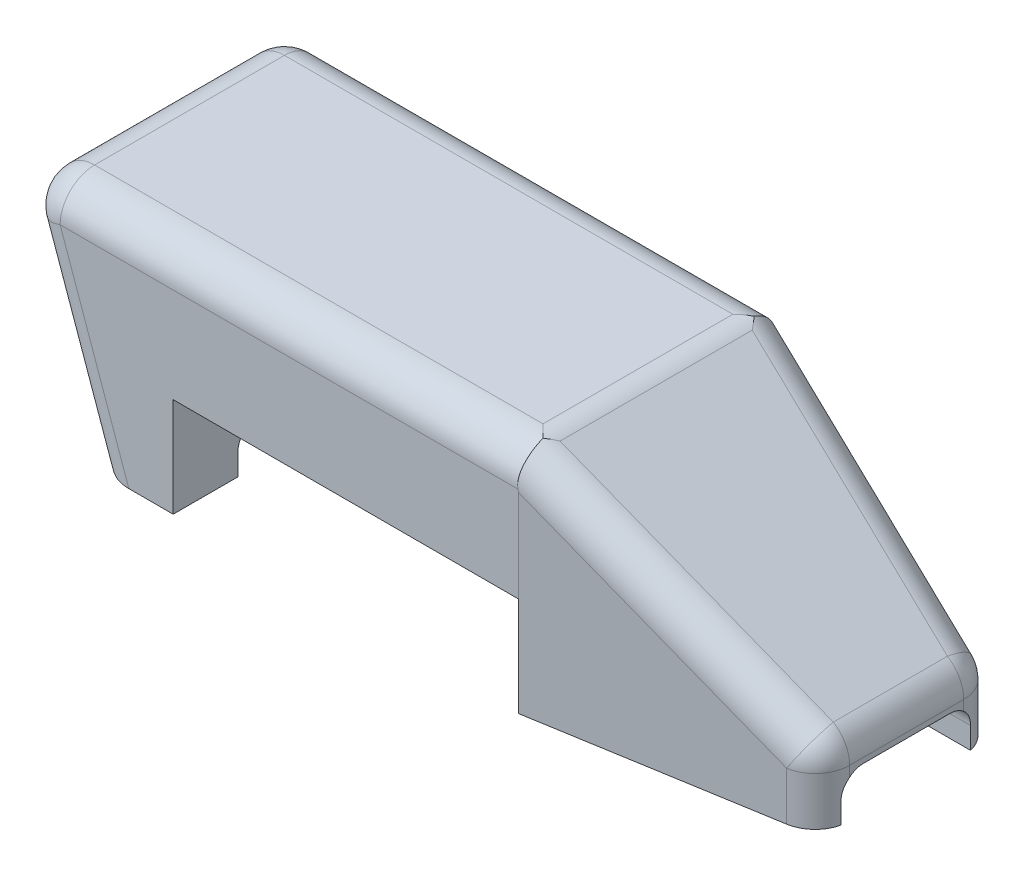
from build123d import *

# Parameters (mm, degrees)
SKETCH1_W            = 140
SKETCH1_H            = 60
BOSS_EXTRUDE2_DEPTH  = 30
SKETCH2_W            = 42
SKETCH2_H            = 23
CUT_EXTRUDE1_DEPTH   = 80
SKETCH3_W            = 60
SKETCH3_H            = 60
BOSS_EXTRUDE3_DEPTH  = 23
CUT_EXTRUDE6_DEPTH   = 156.241746963
SKETCH15_W           = 60
SKETCH15_H           = 30
BOSS_EXTRUDE9_DEPTH  = 20
SKETCH16_W           = 20
SKETCH16_H           = 60
BOSS_EXTRUDE10_DEPTH = 23
CUT_EXTRUDE9_DEPTH   = 162.273060367
CUT_EXTRUDE11_DEPTH  = 162.273060367
SKETCH20_W           = 17.5305996
SKETCH20_H           = 53
BOSS_EXTRUDE11_DEPTH = 60
CUT_EXTRUDE12_DEPTH  = 156.241746963
FILLET8_R            = 8
FILLET9_R            = 8
SKETCH22_W           = 30
SKETCH22_H           = 10
CUT_EXTRUDE13_DEPTH  = 133.454739954
FILLET11_R           = 5
SKETCH23_W           = 8
SKETCH23_H           = 20
CUT_EXTRUDE14_DEPTH  = 35
SKETCH24_W           = 30
SKETCH24_H           = 10
CUT_EXTRUDE15_DEPTH  = 35
FILLET12_R           = 5


with BuildPart() as part:
    # Sketch1 → Boss-Extrude2 (new body)
    with BuildSketch(Plane(origin=(0, 0, 0), x_dir=(1, 0, 0), z_dir=(0, 1, 0))):
        with Locations((70, 30)):
            Rectangle(SKETCH1_W, SKETCH1_H)
    extrude(amount=BOSS_EXTRUDE2_DEPTH)

    # Sketch2 → Cut-Extrude1 (cut)
    with BuildSketch(Plane.ZY):
        with Locations((-30, 11.5)):
            Rectangle(SKETCH2_W, SKETCH2_H)
    extrude(amount=-CUT_EXTRUDE1_DEPTH, mode=Mode.SUBTRACT)

    # Sketch3 → Boss-Extrude3 (add)
    with BuildSketch(Plane.XZ):
        with Locations((110, -30)):
            Rectangle(SKETCH3_W, SKETCH3_H)
    extrude(amount=BOSS_EXTRUDE3_DEPTH)

    # Sketch4 → Cut-Extrude6 (cut, through all)
    with BuildSketch(Plane.XY):
        Polygon((140, -7.341177678), (80, 30), (140, 30), align=None)
    extrude(amount=-CUT_EXTRUDE6_DEPTH, mode=Mode.SUBTRACT)

    # Sketch15 → Boss-Extrude9 (add)
    with BuildSketch(Plane.ZY):
        with Locations((-30, 15)):
            Rectangle(SKETCH15_W, SKETCH15_H)
    extrude(amount=BOSS_EXTRUDE9_DEPTH)

    # Sketch16 → Boss-Extrude10 (add)
    with BuildSketch(Plane.XZ):
        with Locations((-10, -30)):
            Rectangle(SKETCH16_W, SKETCH16_H)
    extrude(amount=BOSS_EXTRUDE10_DEPTH)

    # Sketch17 → Cut-Extrude9 (cut, through all)
    with BuildSketch(Plane.XZ.offset(23)):
        Polygon((80, -60), (140, -50), (140, -60), align=None)
    extrude(amount=-CUT_EXTRUDE9_DEPTH, mode=Mode.SUBTRACT)

    # Sketch18 → Cut-Extrude11 (cut, through all)
    with BuildSketch(Plane.XZ.offset(23)):
        Polygon((80, 0), (140, -10), (140, 0), align=None)
    extrude(amount=-CUT_EXTRUDE11_DEPTH, mode=Mode.SUBTRACT)

    # Sketch20 → Boss-Extrude11 (add, through all)
    with BuildSketch(Plane(origin=(0, 0, -60), x_dir=(-1, 0, 0), z_dir=(0, 0, -1))):
        with Locations((28.7652998, 3.5)):
            Rectangle(SKETCH20_W, SKETCH20_H)
    extrude(amount=-BOSS_EXTRUDE11_DEPTH)

    # Sketch21 → Cut-Extrude12 (cut, through all)
    with BuildSketch(Plane(origin=(0, 0, -60), x_dir=(-1, 0, 0), z_dir=(0, 0, -1))):
        Polygon((18.7652998, -23), (37.5305996, 30), (37.5305996, -23), align=None)
    extrude(amount=-CUT_EXTRUDE12_DEPTH, mode=Mode.SUBTRACT)

    # Fillet8
    # the kernel refuses this fillet: 8 mm, written as the material it takes off along each edge
    with BuildSketch(Plane(origin=(-26.211462289, 22, -52), x_dir=(0, 1, 0), z_dir=(0, 0, -1))) as fillet8_piece_1_section:
        Polygon((0, 0), (FILLET8_R, 0), (FILLET8_R, -FILLET8_R * 1.41489216391), (-FILLET8_R * 0.333759690599, -FILLET8_R * 0.942658193054), align=None)
    fillet8_piece_1 = extrude(amount=FILLET8_R, mode=Mode.PRIVATE)
    fillet8_piece_1 = fillet8_piece_1 - Plane(origin=(-26.211462289, 22, -52), x_dir=(0.816627115211936, -0.5771656215512417, 0), z_dir=(0, 0, -1)) * Sphere(FILLET8_R, mode=Mode.PRIVATE)
    add(fillet8_piece_1, mode=Mode.SUBTRACT)
    with BuildSketch(Plane(origin=(-26.211462289, 22, -8), x_dir=(0, 1, 0), z_dir=(0, 0, 1))) as fillet8_piece_2_section:
        Polygon((0, 0), (FILLET8_R, 0), (FILLET8_R, FILLET8_R * 1.41489216391), (-FILLET8_R * 0.333759690599, FILLET8_R * 0.942658193054), align=None)
    fillet8_piece_2 = extrude(amount=FILLET8_R, mode=Mode.PRIVATE)
    fillet8_piece_2 = fillet8_piece_2 - Plane(origin=(-26.211462289, 22, -8), x_dir=(0.816627115211936, -0.5771656215512417, 0), z_dir=(0, 0, 1)) * Sphere(FILLET8_R, mode=Mode.PRIVATE)
    add(fillet8_piece_2, mode=Mode.SUBTRACT)
    with BuildSketch(Plane(origin=(-37.5305996, 30, -52), x_dir=(1, 0, 0), z_dir=(0, 0, 1))) as fillet8_piece_3:
        with BuildLine():
            CenterArc((FILLET8_R * 1.41489216391, -FILLET8_R), FILLET8_R, 90, 109.497133014)
            Line((FILLET8_R * 0.472233970858, -FILLET8_R * 1.3337596906), (0, 0))
            Line((0, 0), (FILLET8_R * 1.41489216391, 0))
        make_face()
    extrude(amount=44, mode=Mode.SUBTRACT)
    with BuildSketch(Plane(origin=(-33.752727833, 19.329922475, 0), x_dir=(0, 0, -1), z_dir=(0.3337596905987375, -0.9426581930537893, 0))) as fillet8_piece_4:
        with BuildLine():
            CenterArc((FILLET8_R, FILLET8_R), FILLET8_R, 180, 90)
            Line((0, FILLET8_R), (0, 0))
            Line((0, 0), (FILLET8_R, 0))
        make_face()
    extrude(amount=64.904847576, mode=Mode.SUBTRACT)
    with BuildSketch(Plane(origin=(-18.7652998, -23, -74.135352863), x_dir=(-0.33375969059873745, 0.9426581930537893, 0), z_dir=(0, 0, 1))) as fillet8_piece_5:
        with BuildLine():
            CenterArc((FILLET8_R * 0.706767643151, -FILLET8_R), FILLET8_R, 90, 70.502866986)
            Line((-FILLET8_R * 0.235890549903, -FILLET8_R * 0.666240309401), (0, 0))
            Line((0, 0), (FILLET8_R * 0.706767643151, 0))
        make_face()
    extrude(amount=88.270705726, mode=Mode.SUBTRACT)
    with BuildSketch(Plane(origin=(-12.090105988, -41.853163861, -60), x_dir=(0.9426581930537893, 0.3337596905987375, 0), z_dir=(-0.3337596905987375, 0.9426581930537893, 0))) as fillet8_piece_6:
        with BuildLine():
            CenterArc((FILLET8_R, -FILLET8_R), FILLET8_R, 90, 90)
            Line((0, -FILLET8_R), (0, 0))
            Line((0, 0), (FILLET8_R, 0))
        make_face()
    extrude(amount=64.904847576, mode=Mode.SUBTRACT)
    with BuildSketch(Plane(origin=(-26.211462289, 30, -60), x_dir=(0, -1, 0), z_dir=(1, 0, 0)), Plane(origin=(-26.211462289, 30, 0), x_dir=(0, 0, -1), z_dir=(1, 0, 0))) as fillet8_piece_7:
        with BuildLine():
            CenterArc((FILLET8_R, -FILLET8_R), FILLET8_R, 90, 90)
            Line((0, -FILLET8_R), (0, 0))
            Line((0, 0), (FILLET8_R, 0))
        make_face()
    extrude(amount=166.211462289, mode=Mode.SUBTRACT)
    with BuildSketch(Plane(origin=(80, 30, 5.715305101), x_dir=(-1, 0, 0), z_dir=(0, 0, -1))) as fillet8_piece_8:
        with BuildLine():
            CenterArc((FILLET8_R * 0.285765255038, -FILLET8_R), FILLET8_R, 90, 31.896191579)
            Line((-FILLET8_R * 0.24261664781, -FILLET8_R * 0.150993189225), (0, 0))
            Line((0, 0), (FILLET8_R * 0.285765255038, 0))
        make_face()
    extrude(amount=71.430610202, mode=Mode.SUBTRACT)

    # Fillet9
    # the kernel refuses this fillet: 8 mm, written as the material it takes off along each edge
    with BuildSketch(Plane(origin=(132, -11.785128809, -43.222983293), x_dir=(-0.48401910269158954, 0.8713310986405968, -0.08066985044859834), z_dir=(0.7927787698772593, 0.3976147054703528, -0.46195710626163544))) as fillet9_piece_1_section:
        Polygon((-13.665079079, -13.665079079), (13.665079079, -13.665079079), (13.665079079, 13.665079079), (-13.665079079, 13.665079079), align=None)
    fillet9_piece_1 = extrude(amount=13.665079079, mode=Mode.PRIVATE)
    fillet9_piece_1 = split(fillet9_piece_1, bisect_by=Plane(origin=(132, -11.785128809, -43.222983293), z_dir=(0.8406327066696059, -0.5231702543590824, 0.1401054511116011)), keep=Keep.TOP, mode=Mode.PRIVATE)
    fillet9_piece_1 = split(fillet9_piece_1, bisect_by=Plane(origin=(132, -11.785128809, -43.222983293), z_dir=(0, 0, -1)), keep=Keep.TOP, mode=Mode.PRIVATE)
    fillet9_piece_1 = split(fillet9_piece_1, bisect_by=Plane(origin=(132, -11.785128809, -43.222983293), z_dir=(0, 1, 0)), keep=Keep.TOP, mode=Mode.PRIVATE)
    fillet9_piece_1 = split(fillet9_piece_1, bisect_by=Plane(origin=(133.315191898, -11.785128809, -51.114134684), z_dir=(-0.16439898730535743, 0, 0.9863939238321437)), keep=Keep.TOP, mode=Mode.PRIVATE)
    fillet9_piece_1 = split(fillet9_piece_1, bisect_by=Plane(origin=(136.227055223, -4.993074323, -43.222983293), z_dir=(-0.5283819028475878, -0.8490068107754862, 0)), keep=Keep.TOP, mode=Mode.PRIVATE)
    fillet9_piece_1 = split(fillet9_piece_1, bisect_by=Plane(origin=(140, -11.785128809, -43.222983293), z_dir=(-1, 0, 0)), keep=Keep.TOP, mode=Mode.PRIVATE)
    fillet9_piece_1 = fillet9_piece_1 - Plane(origin=(132, -11.785128809, -43.222983293), x_dir=(-0.7927787698772593, -0.3976147054703528, 0.46195710626163544), z_dir=(-0.48401910269158954, 0.8713310986405968, -0.08066985044859834)) * Sphere(FILLET9_R, mode=Mode.PRIVATE)
    add(fillet9_piece_1, mode=Mode.SUBTRACT)
    with BuildSketch(Plane(origin=(132, -11.785128809, -16.777016707), x_dir=(0, 0.7579161794569693, -0.6523519486575872), z_dir=(0.7927787698772593, 0.3976147054703528, 0.46195710626163544))) as fillet9_piece_2_section:
        Polygon((-13.665079079, -13.665079079), (13.665079079, -13.665079079), (13.665079079, 13.665079079), (-13.665079079, 13.665079079), align=None)
    fillet9_piece_2 = extrude(amount=13.665079079, mode=Mode.PRIVATE)
    fillet9_piece_2 = split(fillet9_piece_2, bisect_by=Plane(origin=(132, -11.785128809, -16.777016707), z_dir=(0, 0, 1)), keep=Keep.TOP, mode=Mode.PRIVATE)
    fillet9_piece_2 = split(fillet9_piece_2, bisect_by=Plane(origin=(132, -11.785128809, -16.777016707), z_dir=(0.8406327066696059, -0.5231702543590824, -0.140105451111601)), keep=Keep.TOP, mode=Mode.PRIVATE)
    fillet9_piece_2 = split(fillet9_piece_2, bisect_by=Plane(origin=(132, -11.785128809, -16.777016707), z_dir=(0, 1, 0)), keep=Keep.TOP, mode=Mode.PRIVATE)
    fillet9_piece_2 = split(fillet9_piece_2, bisect_by=Plane(origin=(140, -11.785128809, -16.777016707), z_dir=(-1, 0, 0)), keep=Keep.TOP, mode=Mode.PRIVATE)
    fillet9_piece_2 = split(fillet9_piece_2, bisect_by=Plane(origin=(136.227055223, -4.993074323, -16.777016707), z_dir=(-0.5283819028475878, -0.8490068107754862, 0)), keep=Keep.TOP, mode=Mode.PRIVATE)
    fillet9_piece_2 = split(fillet9_piece_2, bisect_by=Plane(origin=(133.315191898, -11.785128809, -8.885865316), z_dir=(-0.1643989873053573, 0, -0.9863939238321437)), keep=Keep.TOP, mode=Mode.PRIVATE)
    fillet9_piece_2 = fillet9_piece_2 - Plane(origin=(132, -11.785128809, -16.777016707), x_dir=(-0.7927787698772593, -0.3976147054703528, -0.46195710626163544), z_dir=(0, 0.7579161794569693, -0.6523519486575872)) * Sphere(FILLET9_R, mode=Mode.PRIVATE)
    add(fillet9_piece_2, mode=Mode.SUBTRACT)
    with BuildSketch(Plane(origin=(140, -39.942541768, -50), x_dir=(-0.9863939238321437, 0, -0.1643989873053573), z_dir=(0, 1, 0)), Plane(origin=(140, -39.942541768, -10), x_dir=(0, 0, -1), z_dir=(0, 1, 0))) as fillet9_piece_3:
        with BuildLine():
            CenterArc((FILLET9_R * 0.847127088383, FILLET9_R), FILLET9_R, 189.462322208, 80.537677792)
            Line((-FILLET9_R * 0.139266835449, FILLET9_R * 0.835601012695), (0, 0))
            Line((0, 0), (FILLET9_R * 0.847127088383, 0))
        make_face()
    extrude(amount=28.157412959, mode=Mode.SUBTRACT)
    with BuildSketch(Plane(origin=(140, -7.341177678, -16.777016707), x_dir=(0, -1, 0), z_dir=(0, 0, -1))) as fillet9_piece_4:
        with BuildLine():
            CenterArc((FILLET9_R * 0.555493891411, FILLET9_R), FILLET9_R, 211.896191579, 58.103808421)
            Line((-FILLET9_R * 0.293512919364, FILLET9_R * 0.471618097152), (0, 0))
            Line((0, 0), (FILLET9_R * 0.555493891411, 0))
        make_face()
    extrude(amount=26.445966586, mode=Mode.SUBTRACT)
    with BuildSketch(Plane(origin=(137.099294602, -5.535915084, -50.4834509), x_dir=(-0.516051960029516, -0.8522281883121756, -0.08600866000491966), z_dir=(-0.840632706669606, 0.5231702543590825, -0.1401054511116011)), Plane(origin=(137.099294602, -5.535915084, -9.5165491), x_dir=(-0.1189504822205207, 0.07402918485766816, -0.9901365878346354), z_dir=(-0.840632706669606, 0.5231702543590825, 0.140105451111601))) as fillet9_piece_5:
        with BuildLine():
            CenterArc((FILLET9_R * 0.916599247, FILLET9_R), FILLET9_R, 184.983304115, 85.016695885)
            Line((-FILLET9_R * 0.0796208058207, FILLET9_R * 0.913134550261), (0, 0))
            Line((0, 0), (FILLET9_R * 0.916599247, 0))
        make_face()
    extrude(amount=78.609137146, mode=Mode.SUBTRACT)

    # Sketch22 → Cut-Extrude13 (cut, through all)
    with BuildSketch(Plane.ZY.offset(-80)):
        with Locations((-30, -18)):
            Rectangle(SKETCH22_W, SKETCH22_H)
    extrude(amount=-CUT_EXTRUDE13_DEPTH, mode=Mode.SUBTRACT)

    # Fillet11
    fillet11_edges = [part.edges().sort_by_distance(p)[0] for p in [
        (109.900070885, -13, -45),
        (109.900070885, -13, -15),
    ]]
    fillet(fillet11_edges, radius=FILLET11_R)

    # Sketch23 → Cut-Extrude14 (cut)
    with BuildSketch(Plane.XZ.offset(13)):
        with Locations((84, -30)):
            Rectangle(SKETCH23_W, SKETCH23_H)
    extrude(amount=-CUT_EXTRUDE14_DEPTH, mode=Mode.SUBTRACT)

    # Sketch24 → Cut-Extrude15 (cut)
    with BuildSketch(Plane(origin=(0, 0, 0), x_dir=(0, 0, -1), z_dir=(1, 0, 0))):
        with Locations((30, -18)):
            Rectangle(SKETCH24_W, SKETCH24_H)
    extrude(amount=-CUT_EXTRUDE15_DEPTH, mode=Mode.SUBTRACT)

    # Fillet12
    fillet12_edges = [part.edges().sort_by_distance(p)[0] for p in [
        (-11.152961202, -13, -45),
        (-11.152961202, -13, -15),
    ]]
    fillet(fillet12_edges, radius=FILLET12_R)


solid = part.part
